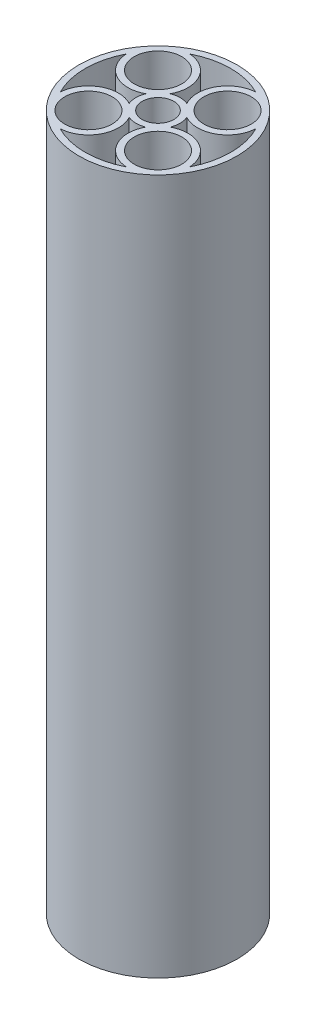
from build123d import *

# Parameters (mm, degrees)
SKETCH1_R           = 125
SKETCH1_R_2         = 37.5
SKETCH1_R_3         = 25
BOSS_EXTRUDE1_DEPTH = 1050
SKETCH2_R           = 125
SKETCH2_R_2         = 25
BOSS_EXTRUDE2_DEPTH = 50
SHELL1_START        = -1090
SHELL1_DEPTH        = 1090
SHELL1_2_DEPTH      = 30


# Read off the part's stored shape, not the designer's step: Shell1
with BuildPart() as part:
    # Sketch1 → Boss-Extrude1 (new body)
    with BuildSketch(Plane(origin=(0, 0, 0), x_dir=(1, 0, 0), z_dir=(0, 1, 0))):
        with Locations(Location((0, 0, 0), (0, 0, 270))):
            Circle(SKETCH1_R)
        with Locations(Location((55, 55, 0), (0, 0, 270))):
            Circle(SKETCH1_R_2, mode=Mode.SUBTRACT)
        with Locations(Location((55, -55, 0), (0, 0, 270))):
            Circle(SKETCH1_R_2, mode=Mode.SUBTRACT)
        with Locations(Location((-55, -55, 0), (0, 0, 270))):
            Circle(SKETCH1_R_2, mode=Mode.SUBTRACT)
        with Locations(Location((-55, 55, 0), (0, 0, 270))):
            Circle(SKETCH1_R_2, mode=Mode.SUBTRACT)
        with Locations(Location((0, 0, 0), (0, 0, 270))):
            Circle(SKETCH1_R_3, mode=Mode.SUBTRACT)
    extrude(amount=-BOSS_EXTRUDE1_DEPTH)

    # Sketch2 → Boss-Extrude2 (add)
    with BuildSketch(Plane.XZ.offset(1050)):
        with Locations(Location((0, 0, 0), (0, 0, 90))):
            Circle(SKETCH2_R)
        with Locations(Location((0, 0, 0), (0, 0, 90))):
            Circle(SKETCH2_R_2, mode=Mode.SUBTRACT)
    extrude(amount=BOSS_EXTRUDE2_DEPTH)

    # Shell1 outline → Shell1 (cut)
    with BuildSketch(Plane(origin=(0, 0, 0), x_dir=(1, 0, 0), z_dir=(0, 1, 0)).offset(SHELL1_START)):
        with BuildLine():
            ThreePointArc((32.408845333, 13.216154667), (35, 0), (32.408845333, -13.216154667))
            ThreePointArc((32.408845333, -13.216154667), (78.149615303, -13.522954405), (102.422807797, -52.293101293))
            ThreePointArc((102.422807797, -52.293101293), (115, 0), (102.422807798, 52.293101293))
            ThreePointArc((102.422807798, 52.293101293), (78.149615303, 13.522954405), (32.408845333, 13.216154667))
        make_face()
        with BuildLine():
            ThreePointArc((-13.216154667, 32.408845333), (0, 35), (13.216154667, 32.408845333))
            ThreePointArc((13.216154667, 32.408845333), (13.522954405, 78.149615303), (52.293101293, 102.422807797))
            ThreePointArc((52.293101293, 102.422807797), (0, 115), (-52.293101293, 102.422807798))
            ThreePointArc((-52.293101293, 102.422807798), (-13.522954405, 78.149615303), (-13.216154667, 32.408845333))
        make_face()
        with BuildLine():
            ThreePointArc((52.293101293, -102.422807797), (13.522954405, -78.149615303), (13.216154667, -32.408845333))
            ThreePointArc((13.216154667, -32.408845333), (0, -35), (-13.216154667, -32.408845333))
            ThreePointArc((-13.216154667, -32.408845333), (-13.522954405, -78.149615303), (-52.293101293, -102.422807797))
            ThreePointArc((-52.293101293, -102.422807797), (0, -115), (52.293101293, -102.422807797))
        make_face()
        with BuildLine():
            ThreePointArc((-32.408845333, -13.216154667), (-35, 0), (-32.408845333, 13.216154667))
            ThreePointArc((-32.408845333, 13.216154667), (-78.149615303, 13.522954405), (-102.422807797, 52.293101293))
            ThreePointArc((-102.422807797, 52.293101293), (-115, 0), (-102.422807798, -52.293101293))
            ThreePointArc((-102.422807798, -52.293101293), (-78.149615303, -13.522954405), (-32.408845333, -13.216154667))
        make_face()
    extrude(amount=SHELL1_DEPTH, mode=Mode.SUBTRACT)

    # Shell1 2 outline → Shell1 2 (cut)
    with BuildSketch(Plane(origin=(0, 0, 0), x_dir=(1, 0, 0), z_dir=(0, 1, 0)).offset(SHELL1_START)):
        with BuildLine():
            ThreePointArc((13.216154667, 32.408845333), (24.748737342, 24.748737342), (32.408845333, 13.216154667))
            ThreePointArc((32.408845333, 13.216154667), (78.149615303, 13.522954405), (102.422807797, 52.293101293))
            ThreePointArc((102.422807797, 52.293101293), (81.317279836, 81.317279836), (52.293101293, 102.422807798))
            ThreePointArc((52.293101293, 102.422807798), (13.522954405, 78.149615303), (13.216154667, 32.408845333))
        make_face()
        with BuildLine():
            ThreePointArc((102.422807797, -52.293101293), (78.149615303, -13.522954405), (32.408845333, -13.216154667))
            ThreePointArc((32.408845333, -13.216154667), (24.748737342, -24.748737342), (13.216154667, -32.408845333))
            ThreePointArc((13.216154667, -32.408845333), (13.522954405, -78.149615303), (52.293101293, -102.422807797))
            ThreePointArc((52.293101293, -102.422807797), (81.317279836, -81.317279836), (102.422807797, -52.293101293))
        make_face()
        with BuildLine():
            ThreePointArc((-32.408845333, 13.216154667), (-24.748737342, 24.748737342), (-13.216154667, 32.408845333))
            ThreePointArc((-13.216154667, 32.408845333), (-13.522954405, 78.149615303), (-52.293101293, 102.422807797))
            ThreePointArc((-52.293101293, 102.422807797), (-81.317279836, 81.317279836), (-102.422807798, 52.293101293))
            ThreePointArc((-102.422807798, 52.293101293), (-78.149615303, 13.522954405), (-32.408845333, 13.216154667))
        make_face()
        with BuildLine():
            ThreePointArc((-52.293101293, -102.422807797), (-13.522954405, -78.149615303), (-13.216154667, -32.408845333))
            ThreePointArc((-13.216154667, -32.408845333), (-24.748737342, -24.748737342), (-32.408845333, -13.216154667))
            ThreePointArc((-32.408845333, -13.216154667), (-78.149615303, -13.522954405), (-102.422807797, -52.293101293))
            ThreePointArc((-102.422807797, -52.293101293), (-81.317279836, -81.317279836), (-52.293101293, -102.422807797))
        make_face()
    extrude(amount=SHELL1_2_DEPTH, mode=Mode.SUBTRACT)


solid = part.part
